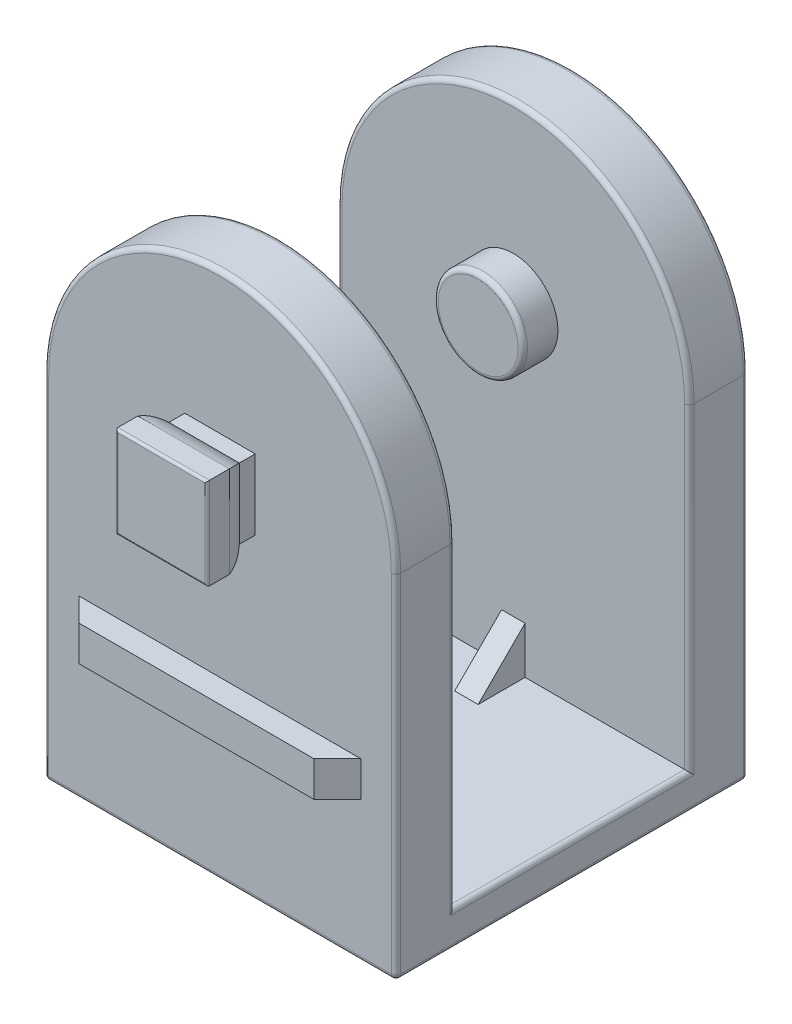
from build123d import *

# Parameters (mm, degrees)
EXTRUDE_1_DEPTH            = 7.5
EXTRUDE_1_DEPTH_BACK       = 7.5
SKETCH_3_W                 = 10
SKETCH_3_H                 = 21
CUT_EXTRUDE_1_DEPTH        = 29.062430401
SKETCH_4_W                 = 3
SKETCH_4_H                 = 3
EXTRUDE_2_DEPTH            = 1
EXTRUDE_3_DEPTH            = 2
EXTRUDE_3_DEPTH_BACK       = 2
CUT_EXTRUDE_2_REACH        = 27.53
SKETCH_7_W                 = 3
SKETCH_7_H                 = 3
EXTRUDE_4_DEPTH            = 1
EXTRUDE_START              = -4
EXTRUDE_5_DEPTH            = 5
CUT_EXTRUDE_3_REACH        = 28.373
SKETCH_10_R                = 1.9
EXTRUDE_6_DEPTH            = 1.5
EXTRUDE_START_2            = 1.5
SKETCH_11_R                = 1.9
EXTRUDE_7_DEPTH            = 1.5
EXTRUDE_8_DEPTH            = 0.5
EXTRUDE_8_DEPTH_BACK       = 0.5
SKETCH_13_W                = 12
SKETCH_13_H                = 1.5
EXTRUDE_9_DEPTH            = 1
CHAMFER_1_SIZE             = 1
CHAMFER_1_OF_MIRROR_2_SIZE = 1
FILLET_1_R                 = 0.1
FILLET_2_R                 = 0.2
FILLET_3_R                 = 0.2
FILLET_4_R                 = 0.1


with BuildPart() as part:
    # 草图1 → 凸台-拉伸1 (new, two sides: drawn at the far end of the back side and taken through both)
    with BuildSketch(Plane.XY.offset(-EXTRUDE_1_DEPTH_BACK)):
        with BuildLine():
            Line((-7.5, 0), (7.5, 0))
            Line((7.5, 0), (7.5, 15))
            ThreePointArc((7.5, 15), (0, 22.5), (-7.5, 15))
            Line((-7.5, 15), (-7.5, 0))
        make_face()
    extrude(amount=EXTRUDE_1_DEPTH + EXTRUDE_1_DEPTH_BACK)

    # 草图3 → 切除-拉伸1 (cut, through all)
    with BuildSketch(Plane.ZY.offset(7.5)):
        with Locations((0, 12)):
            Rectangle(SKETCH_3_W, SKETCH_3_H)
    extrude(amount=-CUT_EXTRUDE_1_DEPTH, mode=Mode.SUBTRACT)

    # 草图4 → 凸台-拉伸2 (add)
    with BuildSketch(Plane(origin=(0, 0, 0), x_dir=(-1, 0, 0), z_dir=(0, -1, 0))):
        Rectangle(SKETCH_4_W, SKETCH_4_H)
    extrude(amount=EXTRUDE_2_DEPTH)

    # 草图5 → 凸台-拉伸3 (add, two sides: drawn at the far end of the back side and taken through both)
    with BuildSketch(Plane.XY.offset(-EXTRUDE_3_DEPTH_BACK)):
        with BuildLine():
            Line((-1.95, -2.5), (1.95, -2.5))
            Line((1.95, -2.5), (1.95, -1.555590279))
            ThreePointArc((1.95, -1.555590279), (1.780042303, -1.088161527), (1.5, -0.677124344))
            Line((1.5, -0.677124344), (-1.5, -0.677124344))
            ThreePointArc((-1.5, -0.677124344), (-1.780042303, -1.088161527), (-1.95, -1.555590279))
            Line((-1.95, -1.555590279), (-1.95, -2.5))
        make_face()
    extrude(amount=EXTRUDE_3_DEPTH + EXTRUDE_3_DEPTH_BACK)

    # 草图6 → 切除-拉伸2 (cut, up to next)
    with BuildSketch(Plane.ZY.offset(1.95), mode=Mode.PRIVATE) as cut_extrude_2_sk1:
        with BuildLine():
            Line((-1.95, -2.5), (-1.95, -1.555590279))
            ThreePointArc((-1.95, -1.555590279), (-1.780042303, -1.088161527), (-1.5, -0.677124344))
            Line((-1.5, -0.677124344), (-2, -0.677124344))
            Line((-2, -0.677124344), (-2, -2.5))
            Line((-2, -2.5), (-1.95, -2.5))
        make_face()
    cut_extrude_2_tool1 = extrude(cut_extrude_2_sk1.sketch, amount=-CUT_EXTRUDE_2_REACH, mode=Mode.PRIVATE) & part.part
    # 草图6 → 切除-拉伸2 (cut, up to next)
    with BuildSketch(Plane.ZY.offset(1.95), mode=Mode.PRIVATE) as cut_extrude_2_sk2:
        with BuildLine():
            Line((2, -2.5), (2, -0.677124344))
            Line((2, -0.677124344), (1.5, -0.677124344))
            ThreePointArc((1.5, -0.677124344), (1.780042303, -1.088161527), (1.95, -1.555590279))
            Line((1.95, -1.555590279), (1.95, -2.5))
            Line((1.95, -2.5), (2, -2.5))
        make_face()
    cut_extrude_2_tool2 = extrude(cut_extrude_2_sk2.sketch, amount=-CUT_EXTRUDE_2_REACH, mode=Mode.PRIVATE) & part.part
    add(cut_extrude_2_tool1.solids().sort_by_distance((-1.95, -1.175075, -1.873038))[0], mode=Mode.SUBTRACT)
    add(cut_extrude_2_tool2.solids().sort_by_distance((-1.95, -1.175075, 1.873038))[0], mode=Mode.SUBTRACT)

    # 草图7 → 凸台-拉伸4 (add)
    with BuildSketch(Plane.XY.offset(7.5)):
        with Locations((0, 15)):
            Rectangle(SKETCH_7_W, SKETCH_7_H)
    extrude_4 = extrude(amount=EXTRUDE_4_DEPTH)

    # 草图8 → 凸台-拉伸5 (add)
    with BuildSketch(Plane(origin=(0, 16.5, 0), x_dir=(1, 0, 0), z_dir=(0, 1, 0)).offset(EXTRUDE_START)):
        with BuildLine():
            Line((-1.95, -10), (1.95, -10))
            Line((1.95, -10), (1.95, -9.055590279))
            ThreePointArc((1.95, -9.055590279), (1.780042303, -8.588161527), (1.5, -8.177124344))
            Line((1.5, -8.177124344), (-1.5, -8.177124344))
            ThreePointArc((-1.5, -8.177124344), (-1.780042303, -8.588161527), (-1.95, -9.055590279))
            Line((-1.95, -9.055590279), (-1.95, -10))
        make_face()
    extrude_5 = extrude(amount=EXTRUDE_5_DEPTH)

    # 草图9 → 切除-拉伸3 (cut, up to next)
    with BuildSketch(Plane.ZY.offset(1.95), mode=Mode.PRIVATE) as cut_extrude_3_sk1:
        with BuildLine():
            Line((10, 16.95), (9.055590279, 16.95))
            ThreePointArc((9.055590279, 16.95), (8.588161527, 16.780042303), (8.177124344, 16.5))
            Line((8.177124344, 16.5), (8.177124344, 17.5))
            Line((8.177124344, 17.5), (10, 17.5))
            Line((10, 17.5), (10, 16.95))
        make_face()
    cut_extrude_3_tool1 = extrude(cut_extrude_3_sk1.sketch, amount=-CUT_EXTRUDE_3_REACH, mode=Mode.PRIVATE) & part.part
    # 草图9 → 切除-拉伸3 (cut, up to next)
    with BuildSketch(Plane.ZY.offset(1.95), mode=Mode.PRIVATE) as cut_extrude_3_sk2:
        with BuildLine():
            Line((10, 12.5), (8.177124344, 12.5))
            Line((8.177124344, 12.5), (8.177124344, 13.5))
            ThreePointArc((8.177124344, 13.5), (8.588161527, 13.219957697), (9.055590279, 13.05))
            Line((9.055590279, 13.05), (10, 13.05))
            Line((10, 13.05), (10, 12.5))
        make_face()
    cut_extrude_3_tool2 = extrude(cut_extrude_3_sk2.sketch, amount=-CUT_EXTRUDE_3_REACH, mode=Mode.PRIVATE) & part.part
    cut_extrude_3_1 = cut_extrude_3_tool1.solids().sort_by_distance((-1.95, 17.169375, 9.000125))[0]
    add(cut_extrude_3_1, mode=Mode.SUBTRACT)
    cut_extrude_3_2 = cut_extrude_3_tool2.solids().sort_by_distance((-1.95, 12.830625, 9.000125))[0]
    add(cut_extrude_3_2, mode=Mode.SUBTRACT)
    cut_extrude_3 = cut_extrude_3_1 + cut_extrude_3_2  # 切除-拉伸3 as one shape, for the pattern or mirror that repeats it

    # 草图10 → 凸台-拉伸6 (add)
    with BuildSketch(Plane.XY.offset(-5)):
        with Locations(Location((0, 15, 0), (0, 0, 180))):
            Circle(SKETCH_10_R)
    extrude(amount=EXTRUDE_6_DEPTH)

    # 草图11 → 凸台-拉伸7 (add)
    with BuildSketch(Plane(origin=(0, 0, 5), x_dir=(-1, 0, 0), z_dir=(0, 0, -1)).offset(EXTRUDE_START_2)):
        with Locations((0, 15)):
            Circle(SKETCH_11_R)
    extrude(amount=-EXTRUDE_7_DEPTH)

    # 镜向1: 凸台-拉伸4, 凸台-拉伸5, 切除-拉伸3 across plane
    add(extrude_4.mirror(Plane.XY))
    add(extrude_5.mirror(Plane.XY))
    add(cut_extrude_3.mirror(Plane.XY), mode=Mode.SUBTRACT)

    # 草图12 → 凸台-拉伸8 (add, two sides: drawn at the far end of the back side and taken through both)
    with BuildSketch(Plane(origin=(0, 0, 0), x_dir=(0, 0, -1), z_dir=(1, 0, 0)).offset(-EXTRUDE_8_DEPTH_BACK)):
        Polygon((5, 1.5), (3, 1.5), (5, 3.5), align=None)
        Polygon((-5, 1.5), (-3, 1.5), (-5, 3.5), align=None)
    extrude(amount=EXTRUDE_8_DEPTH + EXTRUDE_8_DEPTH_BACK)

    # 草图13 → 凸台-拉伸9 (add)
    with BuildSketch(Plane.XY.offset(7.5)):
        with Locations((0, 6.75)):
            Rectangle(SKETCH_13_W, SKETCH_13_H)
    extrude_9 = extrude(amount=EXTRUDE_9_DEPTH)

    # 倒角1
    chamfer_1_edges = [part.edges().sort_by_distance(p)[0] for p in [
        (-6, 6.75, 8.5),
        (6, 6.75, 8.5),
    ]]
    chamfer(chamfer_1_edges, length=CHAMFER_1_SIZE - 0.0001)  # a hair under: the kernel refuses the full size

    # 镜向2: 凸台-拉伸9 across plane
    add(extrude_9.mirror(Plane.XY))

    # 倒角1 of 镜向2
    chamfer_1_of_mirror_2_edges = [part.edges().sort_by_distance(p)[0] for p in [
        (-6, 6.75, -8.5),
        (6, 6.75, -8.5),
    ]]
    chamfer(chamfer_1_of_mirror_2_edges, length=CHAMFER_1_OF_MIRROR_2_SIZE - 0.0001)  # a hair under: the kernel refuses the full size

    # 圆角1
    fillet_1_edges = [part.edges().sort_by_distance(p)[0] for p in [
        (0, 16.95, 10),
        (-1.95, 15, 10),
        (1.95, 15, 10),
        (0, 13.05, 10),
        (0, 16.95, -10),
        (1.95, 15, -10),
        (-1.95, 15, -10),
        (0, 13.05, -10),
    ]]
    fillet(fillet_1_edges, radius=FILLET_1_R)

    # 圆角2
    fillet_2_edges = [part.edges().sort_by_distance(p)[0] for p in [
        (7.5, 7.5, -7.5),
        (-7.5, 7.5, 7.5),
        (0, 0, 7.5),
        (0, 22.5, -7.5),
        (7.5, 7.5, 7.5),
        (0, 22.5, 7.5),
        (7.5, 8.25, -5),
        (0, 22.5, -5),
        (0, 22.5, 5),
        (7.5, 8.25, 5),
        (7.5, 1.5, 0),
        (-7.5, 8.25, 5),
        (-7.5, 8.25, -5),
        (-7.5, 1.5, 0),
        (-7.5, 7.5, -7.5),
        (0, 0, -7.5),
        (7.5, 0, 0),
        (-7.5, 0, 0),
    ]]
    fillet(fillet_2_edges, radius=FILLET_2_R)

    # 圆角3
    fillet_3_edges = [part.edges().sort_by_distance(p)[0] for p in [
        (1.9, 15, -3.5),
        (1.9, 15, 3.5),
    ]]
    fillet(fillet_3_edges, radius=FILLET_3_R)

    # 圆角4
    fillet_4_edges = [part.edges().sort_by_distance(p)[0] for p in [
        (1.95, -2.5, 0),
        (-1.95, -2.5, 0),
        (0, -2.5, -1.95),
        (0, -2.5, 1.95),
    ]]
    fillet(fillet_4_edges, radius=FILLET_4_R)


solid = part.part
